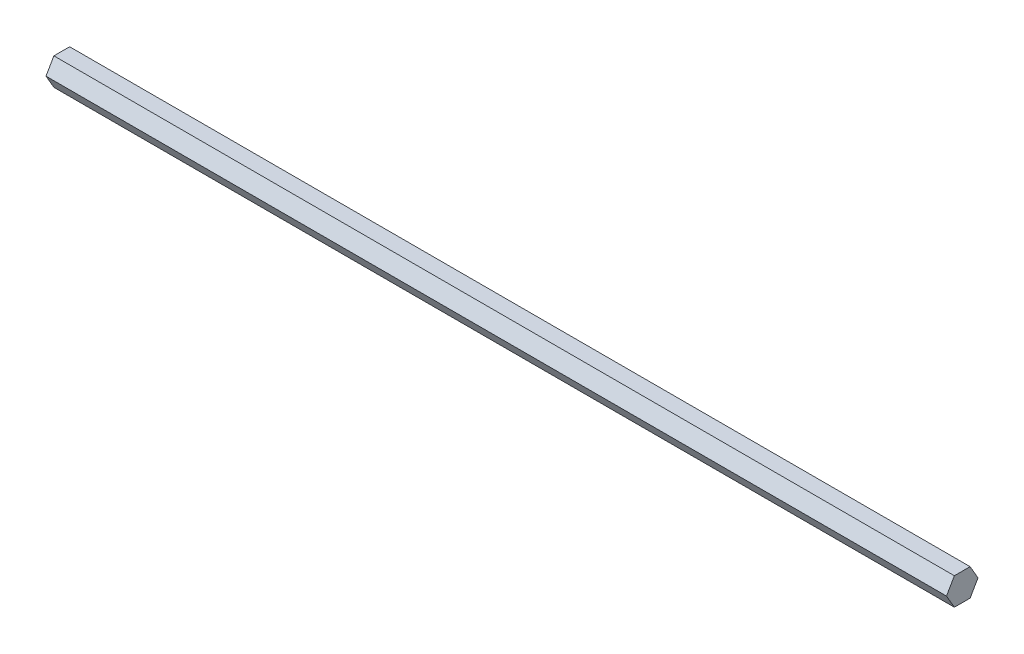
from build123d import *

# Parameters (mm, degrees)
BOSS_EXTRUDE1_DEPTH = 209.55


with BuildPart() as part:
    # Sketch1 → Boss-Extrude1 (new, symmetric)
    with BuildSketch(Plane(origin=(0, 0, 0), x_dir=(0, 0, -1), z_dir=(1, 0, 0))):
        Polygon((7.332348419, 0), (3.666174209, 6.35), (-3.666174209, 6.35), (-7.332348419, 0), (-3.666174209, -6.35), (3.666174209, -6.35), align=None)
    extrude(amount=BOSS_EXTRUDE1_DEPTH, both=True)


solid = part.part
